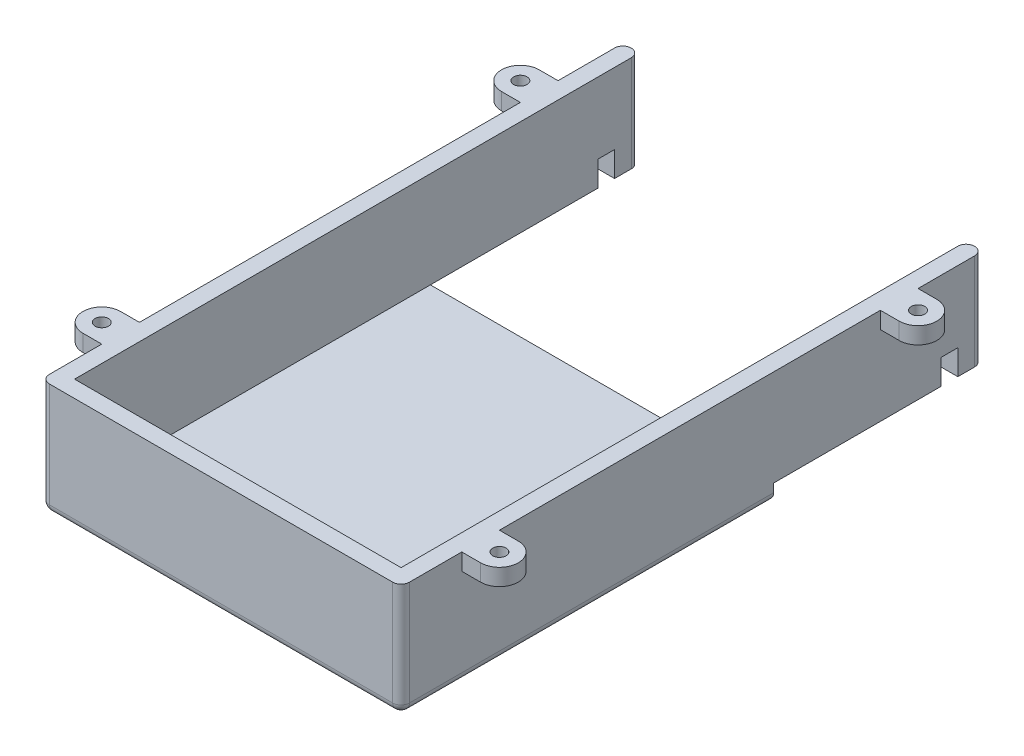
from build123d import *

# Parameters (mm, degrees)
BOSS_EXTRUDE3_DEPTH = 23
SKETCH5_W           = 86
SKETCH5_H           = 89
BOSS_EXTRUDE4_DEPTH = 4
SKETCH7_W           = 86
SKETCH7_H           = 4
CUT_EXTRUDE2_DEPTH  = 6
FILLET2_R           = 2
FILLET3_R           = 2
SKETCH8_R           = 1.6
BOSS_EXTRUDE5_DEPTH = 4
FILLET4_R           = 2


# Some blends are built 0.0001 mm under size
with BuildPart() as part:
    # Sketch2 → Boss-Extrude3 (new body)
    with BuildSketch(Plane(origin=(0, 0, 0), x_dir=(1, 0, 0), z_dir=(0, 1, 0))):
        Polygon((-45.956172868, 28.642659602), (-45.956172868, -110.357340398), (40.043827132, -110.357340398), (40.043827132, 28.642659602), (36.043827132, 28.642659602), (36.043827132, -106.357340398), (-41.956172868, -106.357340398), (-41.956172868, 28.642659602), align=None)
    extrude(amount=BOSS_EXTRUDE3_DEPTH)

    # Sketch5 → Boss-Extrude4 (add)
    with BuildSketch(Plane.XZ):
        with Locations((-2.956172868, 65.857340398)):
            Rectangle(SKETCH5_W, SKETCH5_H)
    extrude(amount=BOSS_EXTRUDE4_DEPTH)

    # Sketch7 → Cut-Extrude2 (cut)
    with BuildSketch(Plane.XZ):
        with Locations((-2.956172868, -20.642659602)):
            Rectangle(SKETCH7_W, SKETCH7_H)
    extrude(amount=-CUT_EXTRUDE2_DEPTH, mode=Mode.SUBTRACT)

    # Fillet2
    fillet2_edges = [part.edges().sort_by_distance(p)[0] for p in [
        (40.043827132, -4, 65.857340398),
        (-2.956172868, -4, 110.357340398),
        (-45.956172868, -4, 65.857340398),
    ]]
    fillet(fillet2_edges, radius=FILLET2_R)

    # Fillet3
    # the kernel refuses this fillet: 2 mm, written as the material it takes off along each edge
    with BuildSketch(Plane(origin=(38.043827132, -2, 108.357340398), x_dir=(1, 0, 0), z_dir=(0, 0, 1))) as fillet3_piece_1_section:
        Polygon((0, 0), (FILLET3_R, 0), (FILLET3_R, -FILLET3_R), (0, -FILLET3_R), align=None)
    fillet3_piece_1 = extrude(amount=FILLET3_R, mode=Mode.PRIVATE)
    fillet3_piece_1 = fillet3_piece_1 - Plane(origin=(38.043827132, -2, 108.357340398), x_dir=(-0.7071067811865475, 0.7071067811865475, 0), z_dir=(0, 0, 1)) * Sphere(FILLET3_R, mode=Mode.PRIVATE)
    add(fillet3_piece_1, mode=Mode.SUBTRACT)
    with BuildSketch(Plane(origin=(-43.956172868, -2, 108.357340398), x_dir=(0, 0, 1), z_dir=(-1, 0, 0))) as fillet3_piece_2_section:
        Polygon((0, 0), (FILLET3_R, 0), (FILLET3_R, -FILLET3_R), (0, -FILLET3_R), align=None)
    fillet3_piece_2 = extrude(amount=FILLET3_R, mode=Mode.PRIVATE)
    fillet3_piece_2 = fillet3_piece_2 - Plane(origin=(-43.956172868, -2, 108.357340398), x_dir=(0, 0.7071067811865475, -0.7071067811865475), z_dir=(-1, 0, 0)) * Sphere(FILLET3_R, mode=Mode.PRIVATE)
    add(fillet3_piece_2, mode=Mode.SUBTRACT)
    with BuildSketch(Plane(origin=(-41.956172868, -5, -28.642659602), x_dir=(-1, 0, 0), z_dir=(0, 1, 0)), Plane(origin=(-45.956172868, -5, -28.642659602), x_dir=(0, 0, 1), z_dir=(0, 1, 0))) as fillet3_piece_3:
        with BuildLine():
            CenterArc((FILLET3_R, FILLET3_R), FILLET3_R, 180, 90)
            Line((0, FILLET3_R), (0, 0))
            Line((0, 0), (FILLET3_R, 0))
        make_face()
    extrude(amount=33, mode=Mode.SUBTRACT)
    with BuildSketch(Plane(origin=(40.043827132, -2, 110.357340398), x_dir=(-1, 0, 0), z_dir=(0, 1, 0)), Plane(origin=(-45.956172868, -2, 110.357340398), x_dir=(0, 0, -1), z_dir=(0, 1, 0))) as fillet3_piece_4:
        with BuildLine():
            CenterArc((FILLET3_R, -FILLET3_R), FILLET3_R, 90, 90)
            Line((0, -FILLET3_R), (0, 0))
            Line((0, 0), (FILLET3_R, 0))
        make_face()
    extrude(amount=30, mode=Mode.SUBTRACT)

    # Sketch8 → Boss-Extrude5 (add)
    # profile 1 of 4: a face of its own
    with BuildSketch(Plane(origin=(0, 23, 0), x_dir=(1, 0, 0), z_dir=(0, 1, 0))):
        with BuildLine():
            Line((40.043827132, -95.857340398), (40.043827132, -86.857340398))
            Line((40.043827132, -86.857340398), (44.543827132, -86.857340398))
            ThreePointArc((44.543827132, -86.857340398), (49.043827132, -91.357340398), (44.543827132, -95.857340398))
            Line((44.543827132, -95.857340398), (40.043827132, -95.857340398))
        make_face()
        with Locations(Location((44.543827132, -91.357340398, 0), (0, 0, 270))):
            Circle(SKETCH8_R, mode=Mode.SUBTRACT)
    # profile 2 of 4: a face of its own
    with BuildSketch(Plane(origin=(0, 23, 0), x_dir=(1, 0, 0), z_dir=(0, 1, 0))):
        with BuildLine():
            Line((-50.456172868, 13.142659602), (-45.956172868, 13.142659602))
            Line((-45.956172868, 13.142659602), (-45.956172868, 4.142659602))
            Line((-45.956172868, 4.142659602), (-50.456172868, 4.142659602))
            ThreePointArc((-50.456172868, 4.142659602), (-54.956172868, 8.642659602), (-50.456172868, 13.142659602))
        make_face()
        with Locations(Location((-50.456172868, 8.642659602, 0), (0, 0, 270))):
            Circle(SKETCH8_R, mode=Mode.SUBTRACT)
    # profile 3 of 4: a face of its own
    with BuildSketch(Plane(origin=(0, 23, 0), x_dir=(1, 0, 0), z_dir=(0, 1, 0))):
        with BuildLine():
            Line((44.543827132, 13.142659602), (40.043827132, 13.142659602))
            Line((40.043827132, 13.142659602), (40.043827132, 4.142659602))
            Line((40.043827132, 4.142659602), (44.543827132, 4.142659602))
            ThreePointArc((44.543827132, 4.142659602), (49.043827132, 8.642659602), (44.543827132, 13.142659602))
        make_face()
        with Locations(Location((44.543827132, 8.642659602, 0), (0, 0, 270))):
            Circle(SKETCH8_R, mode=Mode.SUBTRACT)
    # profile 4 of 4: a face of its own
    with BuildSketch(Plane(origin=(0, 23, 0), x_dir=(1, 0, 0), z_dir=(0, 1, 0))):
        with BuildLine():
            Line((-50.456172868, -86.857340398), (-45.956172868, -86.857340398))
            Line((-45.956172868, -86.857340398), (-45.956172868, -95.857340398))
            Line((-45.956172868, -95.857340398), (-50.456172868, -95.857340398))
            ThreePointArc((-50.456172868, -95.857340398), (-54.956172868, -91.357340398), (-50.456172868, -86.857340398))
        make_face()
        with Locations(Location((-50.456172868, -91.357340398, 0), (0, 0, 270))):
            Circle(SKETCH8_R, mode=Mode.SUBTRACT)
    extrude(amount=-BOSS_EXTRUDE5_DEPTH)

    # Fillet4
    fillet4_edges = [part.edges().sort_by_distance(p)[0] for p in [
        (40.043827132, 11.5, -28.642659602),
        (36.043827132, 11.5, -28.642659602),
    ]]
    fillet(fillet4_edges, radius=FILLET4_R - 0.0001)  # a hair under: the kernel refuses the full size


solid = part.part
